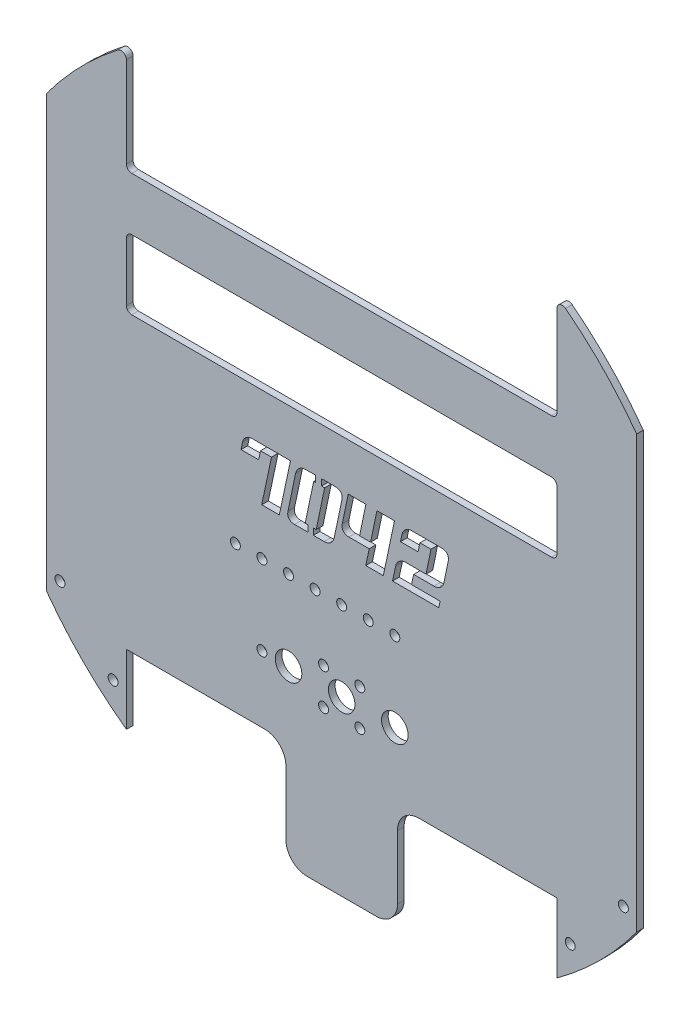
from build123d import *

# Parameters (mm, degrees)
SKETCH1_R               = 2.38125
BOSS_EXTRUDE1_DEPTH     = 3.175
BOSS_EXTRUDE2_DEPTH     = 50.8
CUT_EXTRUDE1_DEPTH      = 209.526843613
CUT_EXTRUDE1_DEPTH_BACK = 209.526843613
SKETCH3_R               = 203.829254644
SKETCH3_R_2             = 174.625
SKETCH5_R               = 2.38125
CUT_EXTRUDE3_DEPTH      = 200.484174202
SKETCH6_W               = 205.731089426
SKETCH6_H               = 25.4
BOSS_EXTRUDE3_DEPTH     = 3.175
SKETCH8_R               = 2.38125
CUT_EXTRUDE5_DEPTH      = 200.484174202
SKETCH9_W               = 205.731089426
SKETCH9_H               = 38.1
BOSS_EXTRUDE4_DEPTH     = 3.175
SKETCH10_R              = 6.35
SKETCH10_R_2            = 2.38125
CUT_EXTRUDE6_DEPTH      = 200.484174202
SKETCH11_W              = 53.331089426
SKETCH11_H              = 50.8
BOSS_EXTRUDE5_DEPTH     = 3.175
FILLET1_R               = 10.16
SKETCH12_R              = 6.35
SKETCH12_R_2            = 2.38125
CUT_EXTRUDE7_DEPTH      = 213.327407372
FILLET2_R               = 2.54
CUT_EXTRUDE8_DEPTH      = 213.327407372
SKETCH14_W              = 2.759281453
SKETCH14_H              = 7.963584416
SKETCH14_W_2            = 2.527010149
SKETCH14_H_2            = 5.938870156
BOSS_EXTRUDE6_DEPTH     = 3.175
FILLET3_R               = 2.54


with BuildPart() as part:
    # Sketch1 → Boss-Extrude1 (new body)
    with BuildSketch(Plane.XY):
        with BuildLine():
            Line((-102.865544713, 31.75), (-102.865544713, 145.022480019))
            ThreePointArc((-102.865544713, 145.022480019), (-123.286100955, 128.114703728), (-140.965544713, 108.358457002))
            Line((-140.965544713, 108.358457002), (-140.965544713, -108.358457002))
            ThreePointArc((-140.965544713, -108.358457002), (-123.286100955, -128.114703728), (-102.865544713, -145.022480019))
            Line((-102.865544713, -145.022480019), (-102.865544713, -69.85))
            Line((-102.865544713, -69.85), (102.865544713, -69.85))
            Line((102.865544713, -69.85), (102.865544713, -145.022480019))
            ThreePointArc((102.865544713, -145.022480019), (123.286100955, -128.114703728), (140.965544713, -108.358457002))
            Line((140.965544713, -108.358457002), (140.965544713, 108.358457002))
            ThreePointArc((140.965544713, 108.358457002), (123.286100955, 128.114703728), (102.865544713, 145.022480019))
            Line((102.865544713, 145.022480019), (102.865544713, 31.75))
            Line((102.865544713, 31.75), (-102.865544713, 31.75))
        make_face()
        with Locations((25.4, -38.1)):
            Circle(SKETCH1_R, mode=Mode.SUBTRACT)
        with Locations((0, -38.1)):
            Circle(SKETCH1_R, mode=Mode.SUBTRACT)
        with Locations((-25.4, -38.1)):
            Circle(SKETCH1_R, mode=Mode.SUBTRACT)
    extrude(amount=BOSS_EXTRUDE1_DEPTH)

    # Sketch2 → Boss-Extrude2 (add)
    with BuildSketch(Plane.XY.offset(3.175)):
        with BuildLine():
            ThreePointArc((-102.865544713, -141.111907137), (-123.390730203, -123.566250752), (-140.965544713, -103.06602655))
            Line((-140.965544713, -103.06602655), (-140.965544713, -108.358457002))
            ThreePointArc((-140.965544713, -108.358457002), (-123.286100955, -128.114703728), (-102.865544713, -145.022480019))
            Line((-102.865544713, -145.022480019), (-102.865544713, -141.111907137))
        make_face()
        with BuildLine():
            ThreePointArc((140.965544713, -103.06602655), (123.390730203, -123.566250752), (102.865544713, -141.111907137))
            Line((102.865544713, -141.111907137), (102.865544713, -145.022480019))
            ThreePointArc((102.865544713, -145.022480019), (123.286100955, -128.114703728), (140.965544713, -108.358457002))
            Line((140.965544713, -108.358457002), (140.965544713, -103.06602655))
        make_face()
    extrude(amount=BOSS_EXTRUDE2_DEPTH)

    # Sketch3 → Cut-Extrude1 (cut, two sides: drawn at the far end of the back side and taken through both)
    with BuildSketch(Plane.XY.offset(3.175).offset(-CUT_EXTRUDE1_DEPTH_BACK)):
        Circle(SKETCH3_R)
        Circle(SKETCH3_R_2, mode=Mode.SUBTRACT)
    extrude(amount=CUT_EXTRUDE1_DEPTH + CUT_EXTRUDE1_DEPTH_BACK, mode=Mode.SUBTRACT)

    # Sketch5 → Cut-Extrude3 (cut, through all)
    with BuildSketch(Plane.XY.offset(3.175)):
        with Locations((134.615544713, -95.585904409)):
            Circle(SKETCH5_R)
        with Locations((109.215544713, -123.814275401)):
            Circle(SKETCH5_R)
        with Locations((-134.615544713, -95.585904409)):
            Circle(SKETCH5_R)
        with Locations((-109.215544713, -123.814275401)):
            Circle(SKETCH5_R)
    extrude(amount=-CUT_EXTRUDE3_DEPTH, mode=Mode.SUBTRACT)

    # Sketch6 → Boss-Extrude3 (add)
    with BuildSketch(Plane.XY.offset(3.175)):
        with Locations((0, 77.611907137)):
            Rectangle(SKETCH6_W, SKETCH6_H)
    extrude(amount=-BOSS_EXTRUDE3_DEPTH)

    # Sketch8 → Cut-Extrude5 (cut, through all)
    with BuildSketch(Plane.XY.offset(3.175)):
        with Locations((-38.1, -38.1)):
            Circle(SKETCH8_R)
        with Locations((-50.8, -38.1)):
            Circle(SKETCH8_R)
        with Locations((12.7, -38.1)):
            Circle(SKETCH8_R)
        with Locations((-12.7, -38.1)):
            Circle(SKETCH8_R)
    extrude(amount=-CUT_EXTRUDE5_DEPTH, mode=Mode.SUBTRACT)

    # Sketch9 → Boss-Extrude4 (add)
    with BuildSketch(Plane.XY.offset(3.175)):
        with Locations((0, -88.9)):
            Rectangle(SKETCH9_W, SKETCH9_H)
    extrude(amount=-BOSS_EXTRUDE4_DEPTH)

    # Sketch10 → Cut-Extrude6 (cut, through all)
    with BuildSketch(Plane.XY.offset(3.175)):
        with Locations((0, -76.2)):
            Circle(SKETCH10_R)
        with Locations((-25.4, -76.2)):
            Circle(SKETCH10_R_2)
        with Locations((-38.1, -76.2)):
            Circle(SKETCH10_R_2)
        with Locations((25.4, -76.2)):
            Circle(SKETCH10_R_2)
    extrude(amount=-CUT_EXTRUDE6_DEPTH, mode=Mode.SUBTRACT)

    # Sketch11 → Boss-Extrude5 (add)
    with BuildSketch(Plane.XY.offset(3.175)):
        with Locations((0, -133.35)):
            Rectangle(SKETCH11_W, SKETCH11_H)
    extrude(amount=-BOSS_EXTRUDE5_DEPTH)

    # Fillet1
    fillet1_edges = [part.edges().sort_by_distance(p)[0] for p in [
        (26.665544713, -107.95, 1.5875),
        (-26.665544713, -107.95, 1.5875),
        (-26.665544713, -158.75, 1.5875),
        (26.665544713, -158.75, 1.5875),
    ]]
    fillet(fillet1_edges, radius=FILLET1_R)

    # Sketch12 → Cut-Extrude7 (cut, through all)
    with BuildSketch(Plane.XY.offset(3.175)):
        with Locations((-25.4, -76.2)):
            Circle(SKETCH12_R)
        with Locations((25.4, -76.2)):
            Circle(SKETCH12_R)
        with Locations((-8.66775, -67.53225)):
            Circle(SKETCH12_R_2)
        with Locations((8.66775, -67.53225)):
            Circle(SKETCH12_R_2)
        with Locations((8.66775, -84.86775)):
            Circle(SKETCH12_R_2)
        with Locations((-8.66775, -84.86775)):
            Circle(SKETCH12_R_2)
    extrude(amount=-CUT_EXTRUDE7_DEPTH, mode=Mode.SUBTRACT)

    # Fillet2
    fillet2_edges = [part.edges().sort_by_distance(p)[0] for p in [
        (102.865544713, 141.111907137, 1.5875),
        (-102.865544713, 141.111907137, 1.5875),
    ]]
    fillet(fillet2_edges, radius=FILLET2_R)

    # Sketch13 → Cut-Extrude8 (cut, through all)
    # profile 1 of 4: a face of its own
    with BuildSketch(Plane.XY.offset(3.175)):
        with BuildLine():
            Line((-29.807958333, -15.810565048), (-38.216416667, -15.810565048))
            Line((-38.216416667, -15.810565048), (-33.538583333, 6.245101619))
            Line((-33.538583333, 6.245101619), (-38.803791667, 6.245101619))
            Line((-38.803791667, 6.245101619), (-39.682208333, 2.075268285))
            Line((-39.682208333, 2.075268285), (-48.095958333, 2.075268285))
            Line((-48.095958333, 2.075268285), (-47.397458333, 5.477809952))
            add(Edge.make_bspline(
                [(-47.397458333, 5.477809952), (-47.320569058, 5.758194134), (-47.170922216, 6.303895823), (-46.789013651, 7.053374007), (-46.29771223, 7.715065901), (-45.690436731, 8.272796577), (-45.006500067, 8.730292102), (-44.253147871, 9.054960677), (-43.448405111, 9.260244914), (-42.891974442, 9.282012228), (-42.6085, 9.293101619)],
                knots=[0, 0, 0, 0, 1.050168006, 2.043904372, 3.024673376, 4.01863537, 5.013909092, 5.989008141, 6.975497172, 8, 8, 8, 8], degree=3))
            Line((-42.6085, 9.293101619), (-24.463375, 9.293101619))
            Line((-24.463375, 9.293101619), (-29.807958333, -15.810565048))
        make_face()
    # profile 2 of 4: a face of its own
    with BuildSketch(Plane.XY.offset(3.175)):
        with BuildLine():
            add(Edge.make_bspline(
                [(-3.566583333, -12.132856715), (-3.643765668, -12.421811436), (-3.79437451, -12.985659844), (-4.17293599, -13.764550451), (-4.665381385, -14.453577746), (-5.270434906, -15.036263062), (-5.950809803, -15.518035961), (-6.703009887, -15.859816489), (-7.511777843, -16.068702787), (-8.070292693, -16.093985699), (-8.355541667, -16.106898381)],
                knots=[0, 0, 0, 0, 1.062369753, 2.073042759, 3.062499936, 4.061251344, 5.048575831, 6.014824268, 6.986115874, 8, 8, 8, 8], degree=3))
            Line((-8.355541667, -16.106898381), (-22.547791667, -16.106898381))
            add(Edge.make_bspline(
                [(-22.547791667, -16.106898381), (-22.69262218, -16.104596964), (-22.972752339, -16.100145578), (-23.378206431, -16.044702396), (-23.755568174, -15.960682303), (-24.107157142, -15.846746121), (-24.426210233, -15.691540895), (-24.716954418, -15.504453058), (-24.976786635, -15.281711317), (-25.203806964, -15.025677099), (-25.40308213, -14.746169713), (-25.554358436, -14.435544628), (-25.674211179, -14.106195373), (-25.74344938, -13.752832717), (-25.791514529, -13.37950469), (-25.77975916, -12.981941289), (-25.73922686, -12.562383844), (-25.682974686, -12.278883611), (-25.654, -12.132856715)],
                knots=[0, 0, 0, 0, 1.158779845, 2.241303809, 3.269110906, 4.251580925, 5.192683609, 6.101443689, 7.012833415, 7.922909267, 8.835720222, 9.751475912, 10.680528402, 11.633319635, 12.628295421, 13.687540584, 14.808885378, 16, 16, 16, 16], degree=3))
            Line((-25.654, -12.132856715), (-21.997458333, 5.319059952))
            add(Edge.make_bspline(
                [(-21.997458333, 5.319059952), (-21.920272116, 5.608009048), (-21.769655695, 6.171846477), (-21.391148554, 6.950815808), (-20.898502375, 7.639552216), (-20.293153244, 8.224337096), (-19.608609326, 8.702683082), (-18.855913228, 9.046275843), (-18.048644228, 9.254382857), (-17.4919553, 9.28003834), (-17.2085, 9.293101619)],
                knots=[0, 0, 0, 0, 1.062516124, 2.073328378, 3.062921881, 4.061810895, 5.05442655, 6.020808115, 6.992233544, 8, 8, 8, 8], degree=3))
            Line((-17.2085, 9.293101619), (-3.01625, 9.293101619))
            add(Edge.make_bspline(
                [(-3.01625, 9.293101619), (-2.871419505, 9.290800192), (-2.591289383, 9.286348788), (-2.185835038, 9.230905733), (-1.808474182, 9.146885197), (-1.456882118, 9.03295056), (-1.137839887, 8.877739913), (-0.847056821, 8.690671483), (-0.587369032, 8.467857656), (-0.359809395, 8.212092615), (-0.16209325, 7.930921186), (-0.002983257, 7.623293687), (0.114459046, 7.2921344), (0.187047795, 6.939473562), (0.223589985, 6.565305639), (0.223678302, 6.168188246), (0.179743785, 5.748571863), (0.123975462, 5.465081675), (0.09525, 5.319059952)],
                knots=[0, 0, 0, 0, 1.158432062, 2.24063113, 3.268129752, 4.250304904, 5.191125136, 6.099612471, 7.010728663, 7.920531375, 8.833068369, 9.75494936, 10.683723015, 11.636228288, 12.62940148, 13.688234619, 14.809242866, 16, 16, 16, 16], degree=3))
            Line((0.09525, 5.319059952), (-3.566583333, -12.132856715))
        make_face()
        Polygon((-13.403791667, 6.245101619), (-17.425458333, -13.058898381), (-12.16025, -13.058898381), (-8.138583333, 6.245101619), align=None, mode=Mode.SUBTRACT)
    # profile 3 of 4: a face of its own
    with BuildSketch(Plane.XY.offset(3.175)):
        with BuildLine():
            Line((11.557, 9.293101619), (8.556625, -5.269565048))
            Line((8.556625, -5.269565048), (13.827125, -5.269565048))
            Line((13.827125, -5.269565048), (16.8275, 9.293101619))
            Line((16.8275, 9.293101619), (25.235958333, 9.293101619))
            Line((25.235958333, 9.293101619), (19.896666667, -16.106898381))
            Line((19.896666667, -16.106898381), (11.482916667, -16.106898381))
            Line((11.482916667, -16.106898381), (13.165666667, -8.317565048))
            Line((13.165666667, -8.317565048), (3.439583333, -8.317565048))
            add(Edge.make_bspline(
                [(3.439583333, -8.317565048), (3.294736233, -8.315312365), (3.014573993, -8.310955241), (2.609344629, -8.25485176), (2.230636814, -8.173029355), (1.881290806, -8.050712181), (1.561052368, -7.897312045), (1.270346477, -7.709804396), (1.009103929, -7.48515858), (0.777806767, -7.227358437), (0.580756638, -6.941550122), (0.426179112, -6.6292081), (0.309007624, -6.297036788), (0.237889907, -5.94070984), (0.190785312, -5.563660832), (0.202000265, -5.162620664), (0.243321079, -4.739613917), (0.29915982, -4.45427987), (0.328083333, -4.306481715)],
                knots=[0, 0, 0, 0, 1.152191709, 2.228561082, 3.250524676, 4.231939746, 5.167691878, 6.071285285, 6.977493388, 7.902223819, 8.821393841, 9.731943086, 10.66895861, 11.616332835, 12.619603957, 13.686867372, 14.801836863, 16, 16, 16, 16], degree=3))
            Line((0.328083333, -4.306481715), (3.14325, 9.293101619))
            Line((3.14325, 9.293101619), (11.557, 9.293101619))
        make_face()
    # profile 4 of 4: a face of its own
    with BuildSketch(Plane.XY.offset(3.175)):
        with BuildLine():
            Line((33.374541667, -13.058898381), (47.0535, -13.058898381))
            Line((47.0535, -13.058898381), (46.392041667, -16.106898381))
            Line((46.392041667, -16.106898381), (24.304625, -16.106898381))
            Line((24.304625, -16.106898381), (25.802166667, -9.143065048))
            add(Edge.make_bspline(
                [(25.802166667, -9.143065048), (25.879273752, -8.861031474), (26.029757165, -8.310610268), (26.410334887, -7.552072135), (26.901419327, -6.879703753), (27.508831265, -6.311820899), (28.191228528, -5.842472815), (28.946271137, -5.513745702), (29.752164487, -5.300517366), (30.311046908, -5.28002739), (30.596416667, -5.269565048)],
                knots=[0, 0, 0, 0, 1.049169808, 2.047576474, 3.031944376, 4.027910562, 5.023553593, 5.994653504, 6.976054309, 8, 8, 8, 8], degree=3))
            Line((30.596416667, -5.269565048), (40.3225, -5.269565048))
            Line((40.3225, -5.269565048), (42.661416667, 6.245101619))
            Line((42.661416667, 6.245101619), (37.396208333, 6.245101619))
            Line((37.396208333, 6.245101619), (36.517791667, 2.075268285))
            Line((36.517791667, 2.075268285), (28.104041667, 2.075268285))
            Line((28.104041667, 2.075268285), (28.802541667, 5.477809952))
            add(Edge.make_bspline(
                [(28.802541667, 5.477809952), (28.879430942, 5.758194134), (29.029077784, 6.303895823), (29.410986349, 7.053374007), (29.90228777, 7.715065901), (30.509563269, 8.272796577), (31.193499933, 8.730292102), (31.946852129, 9.054960677), (32.751594889, 9.260244914), (33.308025558, 9.282012228), (33.5915, 9.293101619)],
                knots=[0, 0, 0, 0, 1.050168006, 2.043904372, 3.024673376, 4.01863537, 5.013909092, 5.989008141, 6.975497172, 8, 8, 8, 8], degree=3))
            Line((33.5915, 9.293101619), (47.78375, 9.293101619))
            add(Edge.make_bspline(
                [(47.78375, 9.293101619), (47.92859726, 9.290849086), (48.208759811, 9.286492252), (48.613987002, 9.230386738), (48.992702458, 9.148571481), (49.342021711, 9.026229282), (49.662353678, 8.87291663), (49.952725098, 8.685096123), (50.214324347, 8.462382804), (50.440285412, 8.20121114), (50.636405741, 7.915869715), (50.798510828, 7.606235104), (50.913345969, 7.272328086), (50.987754572, 6.916671215), (51.023365934, 6.538801464), (51.023963511, 6.138199286), (50.97928388, 5.715135649), (50.923924969, 5.429811378), (50.89525, 5.282018285)],
                knots=[0, 0, 0, 0, 1.152517565, 2.229191352, 3.251443972, 4.233136601, 5.169153376, 6.073002333, 6.979466726, 7.895134038, 8.814564014, 9.731738245, 10.66901877, 11.616660927, 12.618740334, 13.686213184, 14.801498005, 16, 16, 16, 16], degree=3))
            Line((50.89525, 5.282018285), (48.916166667, -4.306481715))
            add(Edge.make_bspline(
                [(48.916166667, -4.306481715), (48.838706266, -4.597052385), (48.687148602, -5.165577869), (48.311448965, -5.952788492), (47.817473721, -6.648200027), (47.212376239, -7.235653604), (46.533647997, -7.724482215), (45.778706123, -8.063324207), (44.971906745, -8.281163221), (44.41262475, -8.30526518), (44.127208333, -8.317565048)],
                knots=[0, 0, 0, 0, 1.06412456, 2.082047477, 3.072647496, 4.071792832, 5.058775816, 6.021176094, 6.990153746, 8, 8, 8, 8], degree=3))
            Line((44.127208333, -8.317565048), (34.395833333, -8.317565048))
            Line((34.395833333, -8.317565048), (33.374541667, -13.058898381))
        make_face()
    extrude(amount=-CUT_EXTRUDE8_DEPTH, mode=Mode.SUBTRACT)


with BuildPart() as cut_extrude8_piece_1:
    # of the separate pieces the step leaves, piece 1, a body of its own (cut_extrude8_pieces)
    add(part.part.solids().sort_by_distance((-106.961346111, 138.033188267, 0))[0])



with BuildPart() as cut_extrude8_piece_2:
    # of the separate pieces the step leaves, piece 2, a body of its own (cut_extrude8_pieces)
    add(part.part.solids().sort_by_distance((-8.138583333, 6.245101619, 0))[0])


with BuildPart() as cut_extrude8_piece_1_1:
    add(cut_extrude8_piece_1.part)

    add(cut_extrude8_piece_2.part)  # Boss-Extrude6 merges Cut-Extrude8 piece 2
    # Sketch14 → Boss-Extrude6 (add)
    with BuildSketch(Plane.XY.offset(3.175)):
        with Locations((-11.017521916, 7.88967512)):
            Rectangle(SKETCH14_W, SKETCH14_H)
        with Locations((-14.795211944, -14.779945163)):
            Rectangle(SKETCH14_W_2, SKETCH14_H_2)
    extrude(amount=-BOSS_EXTRUDE6_DEPTH)

    # Fillet3
    fillet3_edges = [cut_extrude8_piece_1_1.edges().sort_by_distance(p)[0] for p in [
        (-102.865544713, 90.311907137, 1.5875),
        (102.865544713, 90.311907137, 1.5875),
        (102.865544713, 31.75, 1.5875),
        (102.865544713, 64.911907137, 1.5875),
        (-102.865544713, 31.75, 1.5875),
        (-102.865544713, 64.911907137, 1.5875),
    ]]
    fillet(fillet3_edges, radius=FILLET3_R)


solid = cut_extrude8_piece_1_1.part
